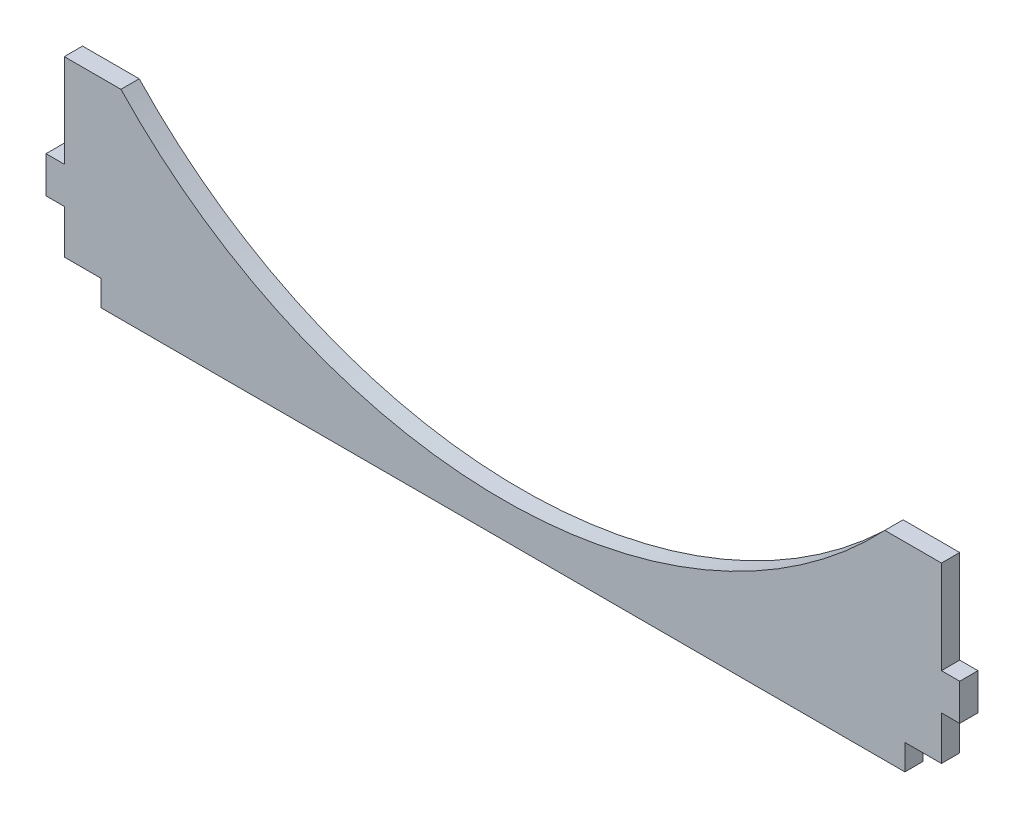
from build123d import *

# Parameters (mm, degrees)
BOSS_EXTRU_1_DEPTH      = 5
ESQUISSE2_W             = 10
ESQUISSE2_H             = 7
ENL_V_MAT_EXTRU_1_DEPTH = 236.935372507


with BuildPart() as part:
    # Esquisse1 → Boss.-Extru.1 (new body)
    with BuildSketch(Plane.XY):
        with BuildLine():
            Line((0, 0), (-15.5, 0))
            Line((-15.5, 0), (-15.5, -25.5))
            Line((-15.5, -25.5), (-20.5, -25.5))
            Line((-20.5, -25.5), (-20.5, -35.5))
            Line((-20.5, -35.5), (-15.5, -35.5))
            Line((-15.5, -35.5), (-15.5, -54.5))
            Line((-15.5, -54.5), (224.5, -54.5))
            Line((224.5, -54.5), (224.5, -35.5))
            Line((224.5, -35.5), (229.5, -35.5))
            Line((229.5, -35.5), (229.5, -25.5))
            Line((229.5, -25.5), (224.5, -25.5))
            Line((224.5, -25.5), (224.5, 0))
            Line((224.5, 0), (209, 0))
            ThreePointArc((209, 0), (104.5, -45), (0, 0))
        make_face()
    extrude(amount=BOSS_EXTRU_1_DEPTH)

    # Esquisse2 → Enlèv. mat.-Extru.1 (cut, through all)
    with BuildSketch(Plane.XY.offset(5)):
        with Locations((-10.5, -51)):
            Rectangle(ESQUISSE2_W, ESQUISSE2_H)
        with Locations((219.5, -51)):
            Rectangle(ESQUISSE2_W, ESQUISSE2_H)
    extrude(amount=-ENL_V_MAT_EXTRU_1_DEPTH, mode=Mode.SUBTRACT)


solid = part.part
